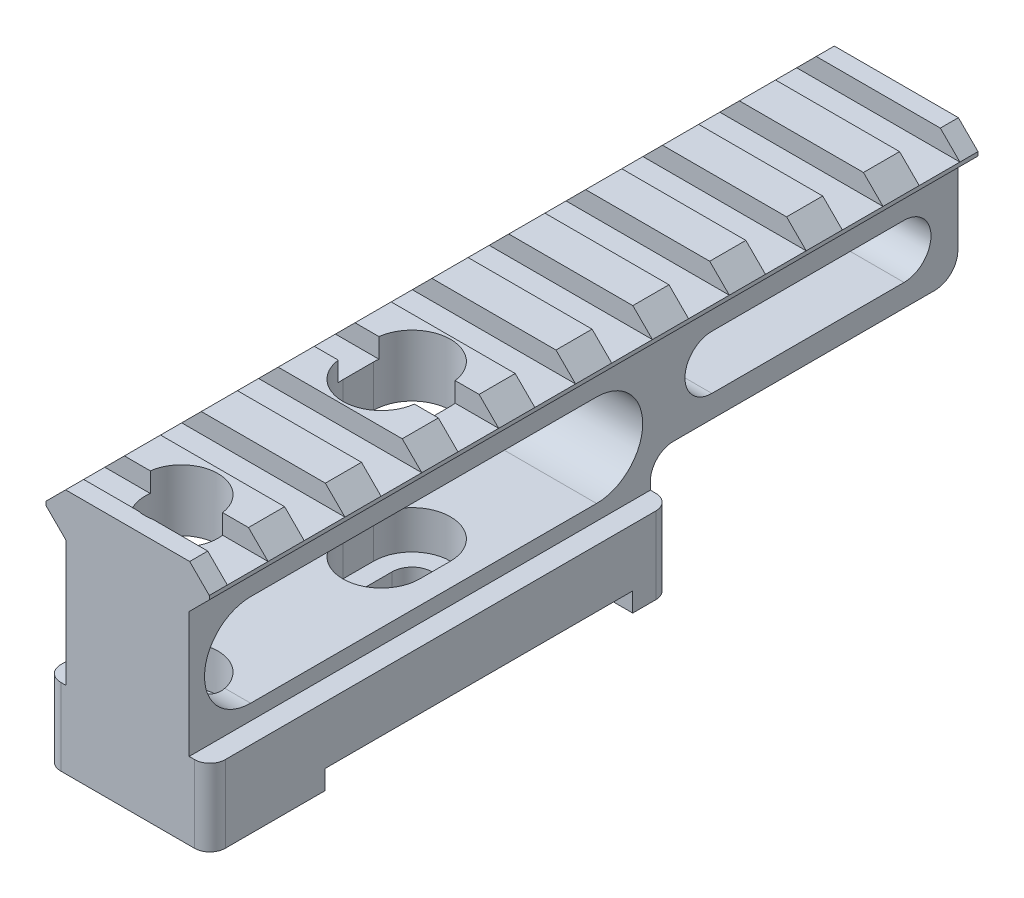
from build123d import *

# Parameters (mm, degrees)
BOSS_EXTRUDE1_START     = 530
BOSS_EXTRUDE1_DEPTH     = 100
SKETCH3_W               = 21.4
SKETCH3_H               = 10
BOSS_EXTRUDE2_DEPTH     = 60
SKETCH4_W               = 21.4
SKETCH4_H               = 40
CUT_EXTRUDE1_DEPTH      = 2.5
CUT_EXTRUDE2_DEPTH      = 16
SKETCH6_W               = 40
SKETCH6_H               = 14
CUT_EXTRUDE3_DEPTH      = 16
FILLET1_R               = 3
CUT_EXTRUDE4_DEPTH      = 16
FILLET2_R               = 2
FILLET3_R               = 3
SKETCH8_W               = 5.3
SKETCH8_H               = 2.55
CUT_EXTRUDE5_DEPTH      = 22
LPATTERN1_COUNT         = 10
LPATTERN1_PITCH         = 10
SKETCH9_R               = 4.75
CUT_EXTRUDE6_DEPTH      = 25
SKETCH10_R              = 2.6
CUT_EXTRUDE7_DEPTH      = 15
CUT_EXTRUDE8_DEPTH      = 15
CUT_EXTRUDE9_DEPTH      = 22
CUT_EXTRUDE9_DEPTH_BACK = 5


with BuildPart() as part:
    # Sketch2 → Boss-Extrude1 (new body)
    with BuildSketch(Plane.XY.offset(BOSS_EXTRUDE1_START)):
        Polygon((-8, 11), (8, 11), (8, 37.33), (10.62, 39.95), (10.62, 40.45), (8.07, 43), (-8.07, 43), (-10.62, 40.45), (-10.62, 39.95), (-8, 37.33), align=None)
    extrude(amount=BOSS_EXTRUDE1_DEPTH)

    # Sketch3 → Boss-Extrude2 (add)
    with BuildSketch(Plane(origin=(0, 0, 630), x_dir=(-1, 0, 0), z_dir=(0, 0, -1))):
        with Locations((0, 16)):
            Rectangle(SKETCH3_W, SKETCH3_H)
    extrude(amount=BOSS_EXTRUDE2_DEPTH)

    # Sketch4 → Cut-Extrude1 (cut)
    with BuildSketch(Plane.XZ.offset(-11)):
        with Locations((0, 595)):
            Rectangle(SKETCH4_W, SKETCH4_H)
    extrude(amount=-CUT_EXTRUDE1_DEPTH, mode=Mode.SUBTRACT)

    # Sketch5 → Cut-Extrude2 (cut)
    with BuildSketch(Plane(origin=(8, 0, 0), x_dir=(0, 0, -1), z_dir=(1, 0, 0))):
        with BuildLine():
            Line((-622, 35), (-577, 35))
            ThreePointArc((-577, 35), (-571, 29), (-577, 23))
            Line((-577, 23), (-622, 23))
            ThreePointArc((-622, 23), (-628, 29), (-622, 35))
        make_face()
    extrude(amount=-CUT_EXTRUDE2_DEPTH, mode=Mode.SUBTRACT)

    # Sketch6 → Cut-Extrude3 (cut)
    with BuildSketch(Plane(origin=(8, 0, 0), x_dir=(0, 0, -1), z_dir=(1, 0, 0))):
        with Locations((-550, 18)):
            Rectangle(SKETCH6_W, SKETCH6_H)
    extrude(amount=-CUT_EXTRUDE3_DEPTH, mode=Mode.SUBTRACT)

    # Fillet1
    fillet1_edges = [part.edges().sort_by_distance(p)[0] for p in [
        (0, 25, 570),
    ]]
    fillet(fillet1_edges, radius=FILLET1_R)

    # Sketch7 → Cut-Extrude4 (cut)
    with BuildSketch(Plane(origin=(8, 0, 0), x_dir=(0, 0, -1), z_dir=(1, 0, 0))):
        with BuildLine():
            Line((-562, 34.9), (-537, 34.9))
            ThreePointArc((-537, 34.9), (-533.5, 31.4), (-537, 27.9))
            Line((-537, 27.9), (-562, 27.9))
            ThreePointArc((-562, 27.9), (-565.5, 31.4), (-562, 34.9))
        make_face()
    extrude(amount=-CUT_EXTRUDE4_DEPTH, mode=Mode.SUBTRACT)

    # Fillet2
    fillet2_edges = [part.edges().sort_by_distance(p)[0] for p in [
        (10.7, 16, 630),
        (10.7, 16, 570),
        (-10.7, 16, 630),
        (-10.7, 16, 570),
    ]]
    fillet(fillet2_edges, radius=FILLET2_R)

    # Fillet3
    fillet3_edges = [part.edges().sort_by_distance(p)[0] for p in [
        (0, 25, 530),
    ]]
    fillet(fillet3_edges, radius=FILLET3_R)

    # Sketch8 → Cut-Extrude5 (cut)
    with BuildSketch(Plane.ZY.offset(10.62)):
        with Locations((535, 41.725)):
            Rectangle(SKETCH8_W, SKETCH8_H)
    cut_extrude5 = extrude(amount=-CUT_EXTRUDE5_DEPTH, mode=Mode.SUBTRACT)

    # LPattern1: Cut-Extrude5 ×10
    with Locations(*[(0, 0, i * LPATTERN1_PITCH) for i in range(1, LPATTERN1_COUNT)]):
        add(cut_extrude5, mode=Mode.SUBTRACT)

    # Sketch9 → Cut-Extrude6 (cut)
    with BuildSketch(Plane(origin=(0, 43, 0), x_dir=(1, 0, 0), z_dir=(0, 1, 0))):
        with Locations((0, -623)):
            Circle(SKETCH9_R)
    extrude(amount=-CUT_EXTRUDE6_DEPTH, mode=Mode.SUBTRACT)

    # Sketch10 → Cut-Extrude7 (cut)
    with BuildSketch(Plane(origin=(0, 18, 0), x_dir=(1, 0, 0), z_dir=(0, 1, 0))):
        with Locations((0, -623)):
            Circle(SKETCH10_R)
    extrude(amount=-CUT_EXTRUDE7_DEPTH, mode=Mode.SUBTRACT)

    # Sketch11 → Cut-Extrude8 (cut)
    with BuildSketch(Plane.XZ.offset(-13.5)):
        with BuildLine():
            Line((2.6, 597), (2.6, 593))
            ThreePointArc((2.6, 593), (0, 590.4), (-2.6, 593))
            Line((-2.6, 593), (-2.6, 597))
            ThreePointArc((-2.6, 597), (0, 599.6), (2.6, 597))
        make_face()
    extrude(amount=-CUT_EXTRUDE8_DEPTH, mode=Mode.SUBTRACT)

    # Sketch12 → Cut-Extrude9 (cut, two sides: drawn at the far end of the back side and taken through both)
    with BuildSketch(Plane(origin=(0, 23, 0), x_dir=(1, 0, 0), z_dir=(0, 1, 0)).offset(-CUT_EXTRUDE9_DEPTH_BACK)):
        with BuildLine():
            Line((-5, -597), (-5, -593))
            ThreePointArc((-5, -593), (0, -588), (5, -593))
            Line((5, -593), (5, -597))
            ThreePointArc((5, -597), (0, -602), (-5, -597))
        make_face()
    extrude(amount=CUT_EXTRUDE9_DEPTH + CUT_EXTRUDE9_DEPTH_BACK, mode=Mode.SUBTRACT)


solid = part.part
